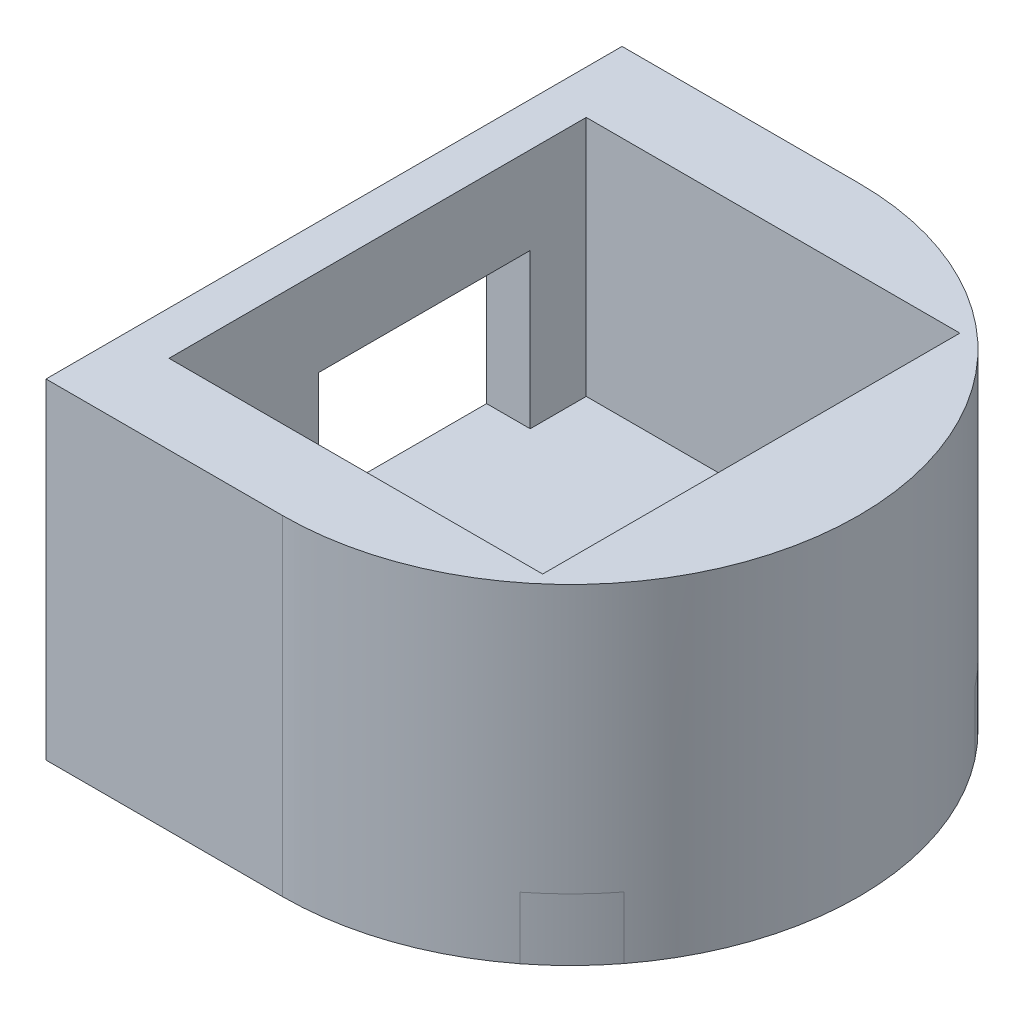
from build123d import *

# Parameters (mm, degrees)
BOSS_EXTRUDE1_DEPTH = 26.5
SKETCH2_W           = 30
SKETCH2_H           = 33.5
CUT_EXTRUDE1_DEPTH  = 19.4
SKETCH4_W           = 17
SKETCH4_H           = 12.4
CUT_EXTRUDE2_DEPTH  = 20
CAVITY1_START       = 2.94
CAVITY1_OUTLINE_R   = 1.683
CAVITY1_DEPTH       = 2.04
CAVITY1_START_2     = 4.98
CAVITY1_2_OUTLINE_R = 2.805
CAVITY1_2_DEPTH     = 1.02
CAVITY1_4_OUTLINE_R = 1.02
CAVITY1_4_DEPTH     = 4.98
SKETCH5_R           = 1.02
SKETCH5_R_2         = 1.029447566
SKETCH5_R_3         = 1.072758169
SKETCH5_R_4         = 5.61
CUT_EXTRUDE3_DEPTH  = 4.98
SKETCH6_R           = 2.805
CUT_EXTRUDE4_DEPTH  = 1
BOSS_EXTRUDE5_START = 4.98
BOSS_EXTRUDE5_DEPTH = 4.98


with BuildPart() as part:
    # Sketch1 → Boss-Extrude1 (new body)
    with BuildSketch(Plane(origin=(0, 0, 0), x_dir=(1, 0, 0), z_dir=(0, 1, 0))):
        with BuildLine():
            Line((0, 0), (0, 46.25))
            Line((0, 46.25), (19, 46.25))
            ThreePointArc((19, 46.25), (42.125, 23.125), (19, 0))
            Line((19, 0), (0, 0))
        make_face()
    extrude(amount=BOSS_EXTRUDE1_DEPTH)

    # Sketch2 → Cut-Extrude1 (cut)
    with BuildSketch(Plane(origin=(0, 26.5, 0), x_dir=(1, 0, 0), z_dir=(0, 1, 0))):
        with Locations((18.5, 23.125)):
            Rectangle(SKETCH2_W, SKETCH2_H)
    extrude(amount=-CUT_EXTRUDE1_DEPTH, mode=Mode.SUBTRACT)

    # Sketch4 → Cut-Extrude2 (cut)
    with BuildSketch(Plane(origin=(3.5, 0, 0), x_dir=(0, 0, -1), z_dir=(1, 0, 0))):
        with Locations((26.875, 13.3)):
            Rectangle(SKETCH4_W, SKETCH4_H)
    extrude(amount=-CUT_EXTRUDE2_DEPTH, mode=Mode.SUBTRACT)

    # Cavity1: read off the stored shape, not the designer's step
    # Cavity1 outline → Cavity1 (cut)
    with BuildSketch(Plane(origin=(0, 0, 0), x_dir=(1, 0, 0), z_dir=(0, 1, 0)).offset(CAVITY1_START)):
        with BuildLine():
            ThreePointArc((22.363714727, 25.434074108), (22.227776518, 25.620567821), (22.081511243, 25.799077123))
            Line((22.081511243, 25.799077123), (21.544048072, 25.486146267))
            Line((21.544048072, 25.486146267), (21.34247524, 25.686250093))
            Line((21.34247524, 25.686250093), (21.651466571, 26.225987749))
            ThreePointArc((21.651466571, 26.225987749), (21.47189222, 26.370943446), (21.284409206, 26.505513952))
            Line((21.284409206, 26.505513952), (20.846252114, 26.064140252))
            Line((20.846252114, 26.064140252), (20.599757028, 26.205254817))
            Line((20.599757028, 26.205254817), (20.75852535, 26.8065742))
            ThreePointArc((20.75852535, 26.8065742), (20.547552552, 26.900113389), (20.331628457, 26.981574342))
            Line((20.331628457, 26.981574342), (20.022637125, 26.441836685))
            Line((20.022637125, 26.441836685), (19.748018019, 26.514345266))
            Line((19.748018019, 26.514345266), (19.745743533, 27.136267453))
            ThreePointArc((19.745743533, 27.136267453), (19.517749735, 27.172015593), (19.288099429, 27.194815563))
            Line((19.288099429, 27.194815563), (19.129331107, 26.59349618))
            Line((19.129331107, 26.59349618), (18.845302817, 26.592457436))
            Line((18.845302817, 26.592457436), (18.682140527, 27.192599459))
            ThreePointArc((18.682140527, 27.192599459), (18.452663129, 27.168120373), (18.224936901, 27.13070558))
            Line((18.224936901, 27.13070558), (18.227211387, 26.508783392))
            Line((18.227211387, 26.508783392), (17.953129974, 26.434268112))
            Line((17.953129974, 26.434268112), (17.640199118, 26.971731283))
            ThreePointArc((17.640199118, 26.971731283), (17.424876627, 26.888693181), (17.214593643, 26.793613381))
            Line((17.214593643, 26.793613381), (17.377755934, 26.193471358))
            Line((17.377755934, 26.193471358), (17.132299592, 26.050557635))
            Line((17.132299592, 26.050557635), (16.690925892, 26.488714727))
            ThreePointArc((16.690925892, 26.488714727), (16.504432179, 26.352776518), (16.325922877, 26.206511243))
            Line((16.325922877, 26.206511243), (16.638853733, 25.669048072))
            Line((16.638853733, 25.669048072), (16.438749907, 25.46747524))
            Line((16.438749907, 25.46747524), (15.899012251, 25.776466571))
            ThreePointArc((15.899012251, 25.776466571), (15.754056554, 25.59689222), (15.619486048, 25.409409206))
            Line((15.619486048, 25.409409206), (16.060859748, 24.971252114))
            Line((16.060859748, 24.971252114), (15.919745183, 24.724757028))
            Line((15.919745183, 24.724757028), (15.3184258, 24.88352535))
            ThreePointArc((15.3184258, 24.88352535), (15.224886611, 24.672552552), (15.143425658, 24.456628457))
            Line((15.143425658, 24.456628457), (15.683163315, 24.147637125))
            Line((15.683163315, 24.147637125), (15.610654734, 23.873018019))
            Line((15.610654734, 23.873018019), (14.988732547, 23.870743533))
            ThreePointArc((14.988732547, 23.870743533), (14.952984407, 23.642749735), (14.930184437, 23.413099429))
            Line((14.930184437, 23.413099429), (15.53150382, 23.254331107))
            Line((15.53150382, 23.254331107), (15.532542564, 22.970302817))
            Line((15.532542564, 22.970302817), (14.932400541, 22.807140527))
            ThreePointArc((14.932400541, 22.807140527), (14.956879627, 22.577663129), (14.99429442, 22.349936901))
            Line((14.99429442, 22.349936901), (15.616216608, 22.352211387))
            Line((15.616216608, 22.352211387), (15.690731888, 22.078129974))
            Line((15.690731888, 22.078129974), (15.153268717, 21.765199118))
            ThreePointArc((15.153268717, 21.765199118), (15.236306819, 21.549876627), (15.331386619, 21.339593643))
            Line((15.331386619, 21.339593643), (15.931528642, 21.502755934))
            Line((15.931528642, 21.502755934), (16.074442365, 21.257299592))
            Line((16.074442365, 21.257299592), (15.636285273, 20.815925892))
            ThreePointArc((15.636285273, 20.815925892), (15.772223482, 20.629432179), (15.918488757, 20.450922877))
            Line((15.918488757, 20.450922877), (16.455951928, 20.763853733))
            Line((16.455951928, 20.763853733), (16.65752476, 20.563749907))
            Line((16.65752476, 20.563749907), (16.348533429, 20.024012251))
            ThreePointArc((16.348533429, 20.024012251), (16.52810778, 19.879056554), (16.715590794, 19.744486048))
            Line((16.715590794, 19.744486048), (17.153747886, 20.185859748))
            Line((17.153747886, 20.185859748), (17.400242972, 20.044745183))
            Line((17.400242972, 20.044745183), (17.24147465, 19.4434258))
            ThreePointArc((17.24147465, 19.4434258), (17.452447448, 19.349886611), (17.668371543, 19.268425658))
            Line((17.668371543, 19.268425658), (17.977362875, 19.808163315))
            Line((17.977362875, 19.808163315), (18.251981981, 19.735654734))
            Line((18.251981981, 19.735654734), (18.254256467, 19.113732547))
            ThreePointArc((18.254256467, 19.113732547), (18.482250265, 19.077984407), (18.711900571, 19.055184437))
            Line((18.711900571, 19.055184437), (18.870668893, 19.65650382))
            Line((18.870668893, 19.65650382), (19.154697183, 19.657542564))
            Line((19.154697183, 19.657542564), (19.317859473, 19.057400541))
            ThreePointArc((19.317859473, 19.057400541), (19.547336871, 19.081879627), (19.775063099, 19.11929442))
            Line((19.775063099, 19.11929442), (19.772788613, 19.741216608))
            Line((19.772788613, 19.741216608), (20.046870026, 19.815731888))
            Line((20.046870026, 19.815731888), (20.359800882, 19.278268717))
            ThreePointArc((20.359800882, 19.278268717), (20.575123373, 19.361306819), (20.785406357, 19.456386619))
            Line((20.785406357, 19.456386619), (20.622244066, 20.056528642))
            Line((20.622244066, 20.056528642), (20.867700408, 20.199442365))
            Line((20.867700408, 20.199442365), (21.309074108, 19.761285273))
            ThreePointArc((21.309074108, 19.761285273), (21.495567821, 19.897223482), (21.674077123, 20.043488757))
            Line((21.674077123, 20.043488757), (21.361146267, 20.580951928))
            Line((21.361146267, 20.580951928), (21.561250093, 20.78252476))
            Line((21.561250093, 20.78252476), (22.100987749, 20.473533429))
            ThreePointArc((22.100987749, 20.473533429), (22.245943446, 20.65310778), (22.380513952, 20.840590794))
            Line((22.380513952, 20.840590794), (21.939140252, 21.278747886))
            Line((21.939140252, 21.278747886), (22.080254817, 21.525242972))
            Line((22.080254817, 21.525242972), (22.6815742, 21.36647465))
            ThreePointArc((22.6815742, 21.36647465), (22.775113389, 21.577447448), (22.856574342, 21.793371543))
            Line((22.856574342, 21.793371543), (22.316836685, 22.102362875))
            Line((22.316836685, 22.102362875), (22.389345266, 22.376981981))
            Line((22.389345266, 22.376981981), (23.011267453, 22.379256467))
            ThreePointArc((23.011267453, 22.379256467), (23.047015593, 22.607250265), (23.069815563, 22.836900571))
            Line((23.069815563, 22.836900571), (22.46849618, 22.995668893))
            Line((22.46849618, 22.995668893), (22.467457436, 23.279697183))
            Line((22.467457436, 23.279697183), (23.067599459, 23.442859473))
            ThreePointArc((23.067599459, 23.442859473), (23.043120373, 23.672336871), (23.00570558, 23.900063099))
            Line((23.00570558, 23.900063099), (22.383783392, 23.897788613))
            Line((22.383783392, 23.897788613), (22.309268112, 24.171870026))
            Line((22.309268112, 24.171870026), (22.846731283, 24.484800882))
            ThreePointArc((22.846731283, 24.484800882), (22.763693181, 24.700123373), (22.668613381, 24.910406357))
            Line((22.668613381, 24.910406357), (22.068471358, 24.747244066))
            Line((22.068471358, 24.747244066), (21.925557635, 24.992700408))
            Line((21.925557635, 24.992700408), (22.363714727, 25.434074108))
        make_face()
        with Locations((19, 23.125)):
            Circle(CAVITY1_OUTLINE_R, mode=Mode.SUBTRACT)
    extrude(amount=CAVITY1_DEPTH, mode=Mode.SUBTRACT)

    # Cavity1 2 outline → Cavity1 2 (cut)
    with BuildSketch(Plane(origin=(0, 0, 0), x_dir=(1, 0, 0), z_dir=(0, 1, 0)).offset(CAVITY1_START_2)):
        with BuildLine():
            ThreePointArc((22.363714727, 25.434074108), (22.227776518, 25.620567821), (22.081511243, 25.799077123))
            Line((22.081511243, 25.799077123), (21.544048072, 25.486146267))
            Line((21.544048072, 25.486146267), (21.34247524, 25.686250093))
            Line((21.34247524, 25.686250093), (21.651466571, 26.225987749))
            ThreePointArc((21.651466571, 26.225987749), (21.47189222, 26.370943446), (21.284409206, 26.505513952))
            Line((21.284409206, 26.505513952), (20.846252114, 26.064140252))
            Line((20.846252114, 26.064140252), (20.599757028, 26.205254817))
            Line((20.599757028, 26.205254817), (20.75852535, 26.8065742))
            ThreePointArc((20.75852535, 26.8065742), (20.547552552, 26.900113389), (20.331628457, 26.981574342))
            Line((20.331628457, 26.981574342), (20.022637125, 26.441836685))
            Line((20.022637125, 26.441836685), (19.748018019, 26.514345266))
            Line((19.748018019, 26.514345266), (19.745743533, 27.136267453))
            ThreePointArc((19.745743533, 27.136267453), (19.517749735, 27.172015593), (19.288099429, 27.194815563))
            Line((19.288099429, 27.194815563), (19.129331107, 26.59349618))
            Line((19.129331107, 26.59349618), (18.845302817, 26.592457436))
            Line((18.845302817, 26.592457436), (18.682140527, 27.192599459))
            ThreePointArc((18.682140527, 27.192599459), (18.452663129, 27.168120373), (18.224936901, 27.13070558))
            Line((18.224936901, 27.13070558), (18.227211387, 26.508783392))
            Line((18.227211387, 26.508783392), (17.953129974, 26.434268112))
            Line((17.953129974, 26.434268112), (17.640199118, 26.971731283))
            ThreePointArc((17.640199118, 26.971731283), (17.424876627, 26.888693181), (17.214593643, 26.793613381))
            Line((17.214593643, 26.793613381), (17.377755934, 26.193471358))
            Line((17.377755934, 26.193471358), (17.132299592, 26.050557635))
            Line((17.132299592, 26.050557635), (16.690925892, 26.488714727))
            ThreePointArc((16.690925892, 26.488714727), (16.504432179, 26.352776518), (16.325922877, 26.206511243))
            Line((16.325922877, 26.206511243), (16.638853733, 25.669048072))
            Line((16.638853733, 25.669048072), (16.438749907, 25.46747524))
            Line((16.438749907, 25.46747524), (15.899012251, 25.776466571))
            ThreePointArc((15.899012251, 25.776466571), (15.754056554, 25.59689222), (15.619486048, 25.409409206))
            Line((15.619486048, 25.409409206), (16.060859748, 24.971252114))
            Line((16.060859748, 24.971252114), (15.919745183, 24.724757028))
            Line((15.919745183, 24.724757028), (15.3184258, 24.88352535))
            ThreePointArc((15.3184258, 24.88352535), (15.224886611, 24.672552552), (15.143425658, 24.456628457))
            Line((15.143425658, 24.456628457), (15.683163315, 24.147637125))
            Line((15.683163315, 24.147637125), (15.610654734, 23.873018019))
            Line((15.610654734, 23.873018019), (14.988732547, 23.870743533))
            ThreePointArc((14.988732547, 23.870743533), (14.952984407, 23.642749735), (14.930184437, 23.413099429))
            Line((14.930184437, 23.413099429), (15.53150382, 23.254331107))
            Line((15.53150382, 23.254331107), (15.532542564, 22.970302817))
            Line((15.532542564, 22.970302817), (14.932400541, 22.807140527))
            ThreePointArc((14.932400541, 22.807140527), (14.956879627, 22.577663129), (14.99429442, 22.349936901))
            Line((14.99429442, 22.349936901), (15.616216608, 22.352211387))
            Line((15.616216608, 22.352211387), (15.690731888, 22.078129974))
            Line((15.690731888, 22.078129974), (15.153268717, 21.765199118))
            ThreePointArc((15.153268717, 21.765199118), (15.236306819, 21.549876627), (15.331386619, 21.339593643))
            Line((15.331386619, 21.339593643), (15.931528642, 21.502755934))
            Line((15.931528642, 21.502755934), (16.074442365, 21.257299592))
            Line((16.074442365, 21.257299592), (15.636285273, 20.815925892))
            ThreePointArc((15.636285273, 20.815925892), (15.772223482, 20.629432179), (15.918488757, 20.450922877))
            Line((15.918488757, 20.450922877), (16.455951928, 20.763853733))
            Line((16.455951928, 20.763853733), (16.65752476, 20.563749907))
            Line((16.65752476, 20.563749907), (16.348533429, 20.024012251))
            ThreePointArc((16.348533429, 20.024012251), (16.52810778, 19.879056554), (16.715590794, 19.744486048))
            Line((16.715590794, 19.744486048), (17.153747886, 20.185859748))
            Line((17.153747886, 20.185859748), (17.400242972, 20.044745183))
            Line((17.400242972, 20.044745183), (17.24147465, 19.4434258))
            ThreePointArc((17.24147465, 19.4434258), (17.452447448, 19.349886611), (17.668371543, 19.268425658))
            Line((17.668371543, 19.268425658), (17.977362875, 19.808163315))
            Line((17.977362875, 19.808163315), (18.251981981, 19.735654734))
            Line((18.251981981, 19.735654734), (18.254256467, 19.113732547))
            ThreePointArc((18.254256467, 19.113732547), (18.482250265, 19.077984407), (18.711900571, 19.055184437))
            Line((18.711900571, 19.055184437), (18.870668893, 19.65650382))
            Line((18.870668893, 19.65650382), (19.154697183, 19.657542564))
            Line((19.154697183, 19.657542564), (19.317859473, 19.057400541))
            ThreePointArc((19.317859473, 19.057400541), (19.547336871, 19.081879627), (19.775063099, 19.11929442))
            Line((19.775063099, 19.11929442), (19.772788613, 19.741216608))
            Line((19.772788613, 19.741216608), (20.046870026, 19.815731888))
            Line((20.046870026, 19.815731888), (20.359800882, 19.278268717))
            ThreePointArc((20.359800882, 19.278268717), (20.575123373, 19.361306819), (20.785406357, 19.456386619))
            Line((20.785406357, 19.456386619), (20.622244066, 20.056528642))
            Line((20.622244066, 20.056528642), (20.867700408, 20.199442365))
            Line((20.867700408, 20.199442365), (21.309074108, 19.761285273))
            ThreePointArc((21.309074108, 19.761285273), (21.495567821, 19.897223482), (21.674077123, 20.043488757))
            Line((21.674077123, 20.043488757), (21.361146267, 20.580951928))
            Line((21.361146267, 20.580951928), (21.561250093, 20.78252476))
            Line((21.561250093, 20.78252476), (22.100987749, 20.473533429))
            ThreePointArc((22.100987749, 20.473533429), (22.245943446, 20.65310778), (22.380513952, 20.840590794))
            Line((22.380513952, 20.840590794), (21.939140252, 21.278747886))
            Line((21.939140252, 21.278747886), (22.080254817, 21.525242972))
            Line((22.080254817, 21.525242972), (22.6815742, 21.36647465))
            ThreePointArc((22.6815742, 21.36647465), (22.775113389, 21.577447448), (22.856574342, 21.793371543))
            Line((22.856574342, 21.793371543), (22.316836685, 22.102362875))
            Line((22.316836685, 22.102362875), (22.389345266, 22.376981981))
            Line((22.389345266, 22.376981981), (23.011267453, 22.379256467))
            ThreePointArc((23.011267453, 22.379256467), (23.047015593, 22.607250265), (23.069815563, 22.836900571))
            Line((23.069815563, 22.836900571), (22.46849618, 22.995668893))
            Line((22.46849618, 22.995668893), (22.467457436, 23.279697183))
            Line((22.467457436, 23.279697183), (23.067599459, 23.442859473))
            ThreePointArc((23.067599459, 23.442859473), (23.043120373, 23.672336871), (23.00570558, 23.900063099))
            Line((23.00570558, 23.900063099), (22.383783392, 23.897788613))
            Line((22.383783392, 23.897788613), (22.309268112, 24.171870026))
            Line((22.309268112, 24.171870026), (22.846731283, 24.484800882))
            ThreePointArc((22.846731283, 24.484800882), (22.763693181, 24.700123373), (22.668613381, 24.910406357))
            Line((22.668613381, 24.910406357), (22.068471358, 24.747244066))
            Line((22.068471358, 24.747244066), (21.925557635, 24.992700408))
            Line((21.925557635, 24.992700408), (22.363714727, 25.434074108))
        make_face()
        with Locations((19, 23.125)):
            Circle(CAVITY1_2_OUTLINE_R, mode=Mode.SUBTRACT)
    extrude(amount=CAVITY1_2_DEPTH, mode=Mode.SUBTRACT)

    # Cavity1 3 outline → Cavity1 3 (revolve, cut)
    with BuildSketch(Plane(origin=(19, 0, -23.125), x_dir=(1, 0, 0), z_dir=(0, 0, 1))):
        Polygon((2.805, 4.98), (5.61, 4.98), (4.59, 6), (2.805, 6), align=None)
    revolve(axis=Axis((19, 0, -23.125), (0, 1, 0)), mode=Mode.SUBTRACT)

    # Cavity1 4 outline → Cavity1 4 (cut)
    with BuildSketch(Plane(origin=(0, 0, 0), x_dir=(1, 0, 0), z_dir=(0, 1, 0))):
        with BuildLine():
            ThreePointArc((28.159014059, 20.859677403), (28.434936904, 23.159505324), (28.142199865, 25.45725355))
            Line((28.142199865, 25.45725355), (37.253349378, 37.322917505))
            ThreePointArc((37.253349378, 37.322917505), (36.577781077, 38.151218334), (35.864659554, 38.947417108))
            ThreePointArc((35.864659554, 38.947417108), (34.988991718, 39.231370443), (34.698641102, 40.104937943))
            ThreePointArc((34.698641102, 40.104937943), (33.897247659, 40.812216773), (33.064027695, 41.481708583))
            Line((33.064027695, 41.481708583), (21.265322597, 32.284014059))
            ThreePointArc((21.265322597, 32.284014059), (18.965494676, 32.559936904), (16.66774645, 32.267199865))
            Line((16.66774645, 32.267199865), (3.742517845, 42.191944975))
            ThreePointArc((3.742517845, 42.191944975), (1.814933217, 42.763576939), (0, 41.898497163))
            Line((0, 41.898497163), (0, 38.014235109))
            Line((0, 38.014235109), (9.840985941, 25.390322597))
            ThreePointArc((9.840985941, 25.390322597), (9.565063096, 23.090494676), (9.857800135, 20.79274645))
            Line((9.857800135, 20.79274645), (0, 7.954701858))
            Line((0, 7.954701858), (0, 4.367062049))
            ThreePointArc((0, 4.367062049), (1.856085865, 3.370476197), (3.88238686, 3.946967636))
            Line((3.88238686, 3.946967636), (16.734677403, 13.965985941))
            ThreePointArc((16.734677403, 13.965985941), (19.034505324, 13.690063096), (21.33225355, 13.982800135))
            Line((21.33225355, 13.982800135), (33.197917505, 4.871650622))
            ThreePointArc((33.197917505, 4.871650622), (34.026218334, 5.547218923), (34.822417108, 6.260340446))
            ThreePointArc((34.822417108, 6.260340446), (35.106370443, 7.136008282), (35.979937943, 7.426358898))
            ThreePointArc((35.979937943, 7.426358898), (36.687216773, 8.227752341), (37.356708583, 9.060972305))
            Line((37.356708583, 9.060972305), (28.159014059, 20.859677403))
        make_face()
        with Locations((2.292401913, 6.294747739)):
            Circle(CAVITY1_4_OUTLINE_R, mode=Mode.SUBTRACT)
        with Locations((5.88543376, 9.914156827)):
            Circle(CAVITY1_4_OUTLINE_R, mode=Mode.SUBTRACT)
        with Locations((9.478465606, 13.533565916)):
            Circle(CAVITY1_4_OUTLINE_R, mode=Mode.SUBTRACT)
        with Locations((13.071497453, 17.152975004)):
            Circle(CAVITY1_4_OUTLINE_R, mode=Mode.SUBTRACT)
        with Locations((32.210843173, 10.01043376)):
            Circle(CAVITY1_4_OUTLINE_R, mode=Mode.SUBTRACT)
        with Locations((24.972024996, 17.196497453)):
            Circle(CAVITY1_4_OUTLINE_R, mode=Mode.SUBTRACT)
        with Locations((28.591434084, 13.603465606)):
            Circle(CAVITY1_4_OUTLINE_R, mode=Mode.SUBTRACT)
        with Locations((9.408565916, 32.646534394)):
            Circle(CAVITY1_4_OUTLINE_R, mode=Mode.SUBTRACT)
        with BuildLine():
            Line((21.544048072, 25.486146267), (22.081511243, 25.799077123))
            ThreePointArc((22.081511243, 25.799077123), (22.227776518, 25.620567821), (22.363714727, 25.434074108))
            Line((22.363714727, 25.434074108), (21.925557635, 24.992700408))
            Line((21.925557635, 24.992700408), (22.068471358, 24.747244066))
            Line((22.068471358, 24.747244066), (22.668613381, 24.910406357))
            ThreePointArc((22.668613381, 24.910406357), (22.763693181, 24.700123373), (22.846731283, 24.484800882))
            Line((22.846731283, 24.484800882), (22.309268112, 24.171870026))
            Line((22.309268112, 24.171870026), (22.383783392, 23.897788613))
            Line((22.383783392, 23.897788613), (23.00570558, 23.900063099))
            ThreePointArc((23.00570558, 23.900063099), (23.043120373, 23.672336871), (23.067599459, 23.442859473))
            Line((23.067599459, 23.442859473), (22.467457436, 23.279697183))
            Line((22.467457436, 23.279697183), (22.46849618, 22.995668893))
            Line((22.46849618, 22.995668893), (23.069815563, 22.836900571))
            ThreePointArc((23.069815563, 22.836900571), (23.047015593, 22.607250265), (23.011267453, 22.379256467))
            Line((23.011267453, 22.379256467), (22.389345266, 22.376981981))
            Line((22.389345266, 22.376981981), (22.316836685, 22.102362875))
            Line((22.316836685, 22.102362875), (22.856574342, 21.793371543))
            ThreePointArc((22.856574342, 21.793371543), (22.775113389, 21.577447448), (22.6815742, 21.36647465))
            Line((22.6815742, 21.36647465), (22.080254817, 21.525242972))
            Line((22.080254817, 21.525242972), (21.939140252, 21.278747886))
            Line((21.939140252, 21.278747886), (22.380513952, 20.840590794))
            ThreePointArc((22.380513952, 20.840590794), (22.245943446, 20.65310778), (22.100987749, 20.473533429))
            Line((22.100987749, 20.473533429), (21.561250093, 20.78252476))
            Line((21.561250093, 20.78252476), (21.361146267, 20.580951928))
            Line((21.361146267, 20.580951928), (21.674077123, 20.043488757))
            ThreePointArc((21.674077123, 20.043488757), (21.495567821, 19.897223482), (21.309074108, 19.761285273))
            Line((21.309074108, 19.761285273), (20.867700408, 20.199442365))
            Line((20.867700408, 20.199442365), (20.622244066, 20.056528642))
            Line((20.622244066, 20.056528642), (20.785406357, 19.456386619))
            ThreePointArc((20.785406357, 19.456386619), (20.575123373, 19.361306819), (20.359800882, 19.278268717))
            Line((20.359800882, 19.278268717), (20.046870026, 19.815731888))
            Line((20.046870026, 19.815731888), (19.772788613, 19.741216608))
            Line((19.772788613, 19.741216608), (19.775063099, 19.11929442))
            ThreePointArc((19.775063099, 19.11929442), (19.547336871, 19.081879627), (19.317859473, 19.057400541))
            Line((19.317859473, 19.057400541), (19.154697183, 19.657542564))
            Line((19.154697183, 19.657542564), (18.870668893, 19.65650382))
            Line((18.870668893, 19.65650382), (18.711900571, 19.055184437))
            ThreePointArc((18.711900571, 19.055184437), (18.482250265, 19.077984407), (18.254256467, 19.113732547))
            Line((18.254256467, 19.113732547), (18.251981981, 19.735654734))
            Line((18.251981981, 19.735654734), (17.977362875, 19.808163315))
            Line((17.977362875, 19.808163315), (17.668371543, 19.268425658))
            ThreePointArc((17.668371543, 19.268425658), (17.452447448, 19.349886611), (17.24147465, 19.4434258))
            Line((17.24147465, 19.4434258), (17.400242972, 20.044745183))
            Line((17.400242972, 20.044745183), (17.153747886, 20.185859748))
            Line((17.153747886, 20.185859748), (16.715590794, 19.744486048))
            ThreePointArc((16.715590794, 19.744486048), (16.52810778, 19.879056554), (16.348533429, 20.024012251))
            Line((16.348533429, 20.024012251), (16.65752476, 20.563749907))
            Line((16.65752476, 20.563749907), (16.455951928, 20.763853733))
            Line((16.455951928, 20.763853733), (15.918488757, 20.450922877))
            ThreePointArc((15.918488757, 20.450922877), (15.772223482, 20.629432179), (15.636285273, 20.815925892))
            Line((15.636285273, 20.815925892), (16.074442365, 21.257299592))
            Line((16.074442365, 21.257299592), (15.931528642, 21.502755934))
            Line((15.931528642, 21.502755934), (15.331386619, 21.339593643))
            ThreePointArc((15.331386619, 21.339593643), (15.236306819, 21.549876627), (15.153268717, 21.765199118))
            Line((15.153268717, 21.765199118), (15.690731888, 22.078129974))
            Line((15.690731888, 22.078129974), (15.616216608, 22.352211387))
            Line((15.616216608, 22.352211387), (14.99429442, 22.349936901))
            ThreePointArc((14.99429442, 22.349936901), (14.956879627, 22.577663129), (14.932400541, 22.807140527))
            Line((14.932400541, 22.807140527), (15.532542564, 22.970302817))
            Line((15.532542564, 22.970302817), (15.53150382, 23.254331107))
            Line((15.53150382, 23.254331107), (14.930184437, 23.413099429))
            ThreePointArc((14.930184437, 23.413099429), (14.952984407, 23.642749735), (14.988732547, 23.870743533))
            Line((14.988732547, 23.870743533), (15.610654734, 23.873018019))
            Line((15.610654734, 23.873018019), (15.683163315, 24.147637125))
            Line((15.683163315, 24.147637125), (15.143425658, 24.456628457))
            ThreePointArc((15.143425658, 24.456628457), (15.224886611, 24.672552552), (15.3184258, 24.88352535))
            Line((15.3184258, 24.88352535), (15.919745183, 24.724757028))
            Line((15.919745183, 24.724757028), (16.060859748, 24.971252114))
            Line((16.060859748, 24.971252114), (15.619486048, 25.409409206))
            ThreePointArc((15.619486048, 25.409409206), (15.754056554, 25.59689222), (15.899012251, 25.776466571))
            Line((15.899012251, 25.776466571), (16.438749907, 25.46747524))
            Line((16.438749907, 25.46747524), (16.638853733, 25.669048072))
            Line((16.638853733, 25.669048072), (16.325922877, 26.206511243))
            ThreePointArc((16.325922877, 26.206511243), (16.504432179, 26.352776518), (16.690925892, 26.488714727))
            Line((16.690925892, 26.488714727), (17.132299592, 26.050557635))
            Line((17.132299592, 26.050557635), (17.377755934, 26.193471358))
            Line((17.377755934, 26.193471358), (17.214593643, 26.793613381))
            ThreePointArc((17.214593643, 26.793613381), (17.424876627, 26.888693181), (17.640199118, 26.971731283))
            Line((17.640199118, 26.971731283), (17.953129974, 26.434268112))
            Line((17.953129974, 26.434268112), (18.227211387, 26.508783392))
            Line((18.227211387, 26.508783392), (18.224936901, 27.13070558))
            ThreePointArc((18.224936901, 27.13070558), (18.452663129, 27.168120373), (18.682140527, 27.192599459))
            Line((18.682140527, 27.192599459), (18.845302817, 26.592457436))
            Line((18.845302817, 26.592457436), (19.129331107, 26.59349618))
            Line((19.129331107, 26.59349618), (19.288099429, 27.194815563))
            ThreePointArc((19.288099429, 27.194815563), (19.517749735, 27.172015593), (19.745743533, 27.136267453))
            Line((19.745743533, 27.136267453), (19.748018019, 26.514345266))
            Line((19.748018019, 26.514345266), (20.022637125, 26.441836685))
            Line((20.022637125, 26.441836685), (20.331628457, 26.981574342))
            ThreePointArc((20.331628457, 26.981574342), (20.547552552, 26.900113389), (20.75852535, 26.8065742))
            Line((20.75852535, 26.8065742), (20.599757028, 26.205254817))
            Line((20.599757028, 26.205254817), (20.846252114, 26.064140252))
            Line((20.846252114, 26.064140252), (21.284409206, 26.505513952))
            ThreePointArc((21.284409206, 26.505513952), (21.47189222, 26.370943446), (21.651466571, 26.225987749))
            Line((21.651466571, 26.225987749), (21.34247524, 25.686250093))
            Line((21.34247524, 25.686250093), (21.544048072, 25.486146267))
        make_face(mode=Mode.SUBTRACT)
        with Locations((13.027975004, 29.053502547)):
            Circle(CAVITY1_4_OUTLINE_R, mode=Mode.SUBTRACT)
        with Locations((5.789156827, 36.23956624)):
            Circle(CAVITY1_4_OUTLINE_R, mode=Mode.SUBTRACT)
        with Locations((2.169747739, 39.832598087)):
            Circle(CAVITY1_4_OUTLINE_R, mode=Mode.SUBTRACT)
        with Locations((24.928502547, 29.097024996)):
            Circle(CAVITY1_4_OUTLINE_R, mode=Mode.SUBTRACT)
        with Locations((28.521534394, 32.716434084)):
            Circle(CAVITY1_4_OUTLINE_R, mode=Mode.SUBTRACT)
        with Locations((32.11456624, 36.335843173)):
            Circle(CAVITY1_4_OUTLINE_R, mode=Mode.SUBTRACT)
    extrude(amount=CAVITY1_4_DEPTH, mode=Mode.SUBTRACT)

    # Sketch5 → Cut-Extrude3 (cut)
    with BuildSketch(Plane.XZ):
        with Locations((2.292401913, -6.294747739)):
            Circle(SKETCH5_R)
        with Locations((5.88543376, -9.914156827)):
            Circle(SKETCH5_R)
        with Locations((9.478465606, -13.533565916)):
            Circle(SKETCH5_R)
        with Locations((13.071497453, -17.152975004)):
            Circle(SKETCH5_R)
        with Locations((24.972024996, -17.196497453)):
            Circle(SKETCH5_R)
        with Locations((28.591434084, -13.603465606)):
            Circle(SKETCH5_R)
        with Locations((32.210843173, -10.01043376)):
            Circle(SKETCH5_R)
        with Locations((24.928502547, -29.097024996)):
            Circle(SKETCH5_R_2)
        with Locations((28.521534394, -32.716434084)):
            Circle(SKETCH5_R_3)
        with Locations((32.11456624, -36.335843173)):
            Circle(SKETCH5_R)
        with Locations((35.707598087, -39.955252261)):
            Circle(SKETCH5_R)
        with Locations((2.169747739, -39.832598087)):
            Circle(SKETCH5_R)
        with Locations((5.789156827, -36.23956624)):
            Circle(SKETCH5_R)
        with Locations((9.408565916, -32.646534394)):
            Circle(SKETCH5_R)
        with Locations((13.027975004, -29.053502547)):
            Circle(SKETCH5_R)
        with Locations((35.830252261, -6.417401913)):
            Circle(SKETCH5_R)
        with Locations((19, -23.125)):
            Circle(SKETCH5_R_4)
    extrude(amount=-CUT_EXTRUDE3_DEPTH, mode=Mode.SUBTRACT)

    # Sketch6 → Cut-Extrude4 (cut)
    with BuildSketch(Plane.XZ.offset(-4.98)):
        with Locations(Location((19, -23.125, 0), (0, 0, 314.790459582))):
            Circle(SKETCH6_R)
    extrude(amount=-CUT_EXTRUDE4_DEPTH, mode=Mode.SUBTRACT)

    # Sketch7 → Boss-Extrude5 (add)
    with BuildSketch(Plane.XZ.offset(-4.98).offset(BOSS_EXTRUDE5_START)):
        with BuildLine():
            Line((0, -4.367062049), (0, -7.954701858))
            Line((0, -7.954701858), (1, -9.25702534))
            Line((1, -9.25702534), (1, -3.604314182))
            ThreePointArc((1, -3.604314182), (0.456699342, -3.928918821), (0, -4.367062049))
        make_face()
        with BuildLine():
            Line((0, -38.014235109), (0, -41.898497163))
            ThreePointArc((0, -41.898497163), (0.46320346, -42.290950198), (1, -42.574545515))
            Line((1, -42.574545515), (1, -36.731445703))
            Line((1, -36.731445703), (0, -38.014235109))
        make_face()
        with BuildLine():
            Line((32.404767765, -5.480677297), (36.741896884, -9.84964624))
            Line((36.741896884, -9.84964624), (37.356708583, -9.060972305))
            ThreePointArc((37.356708583, -9.060972305), (35.411731696, -6.832872417), (33.197917505, -4.871650622))
            Line((33.197917505, -4.871650622), (32.404767765, -5.480677297))
        make_face()
        with BuildLine():
            Line((36.644322703, -36.529767765), (32.27535376, -40.866896884))
            Line((32.27535376, -40.866896884), (33.064027695, -41.481708583))
            ThreePointArc((33.064027695, -41.481708583), (35.291905195, -39.536507675), (37.253349378, -37.322917505))
            Line((37.253349378, -37.322917505), (36.644322703, -36.529767765))
        make_face()
    extrude(amount=-BOSS_EXTRUDE5_DEPTH)


solid = part.part
